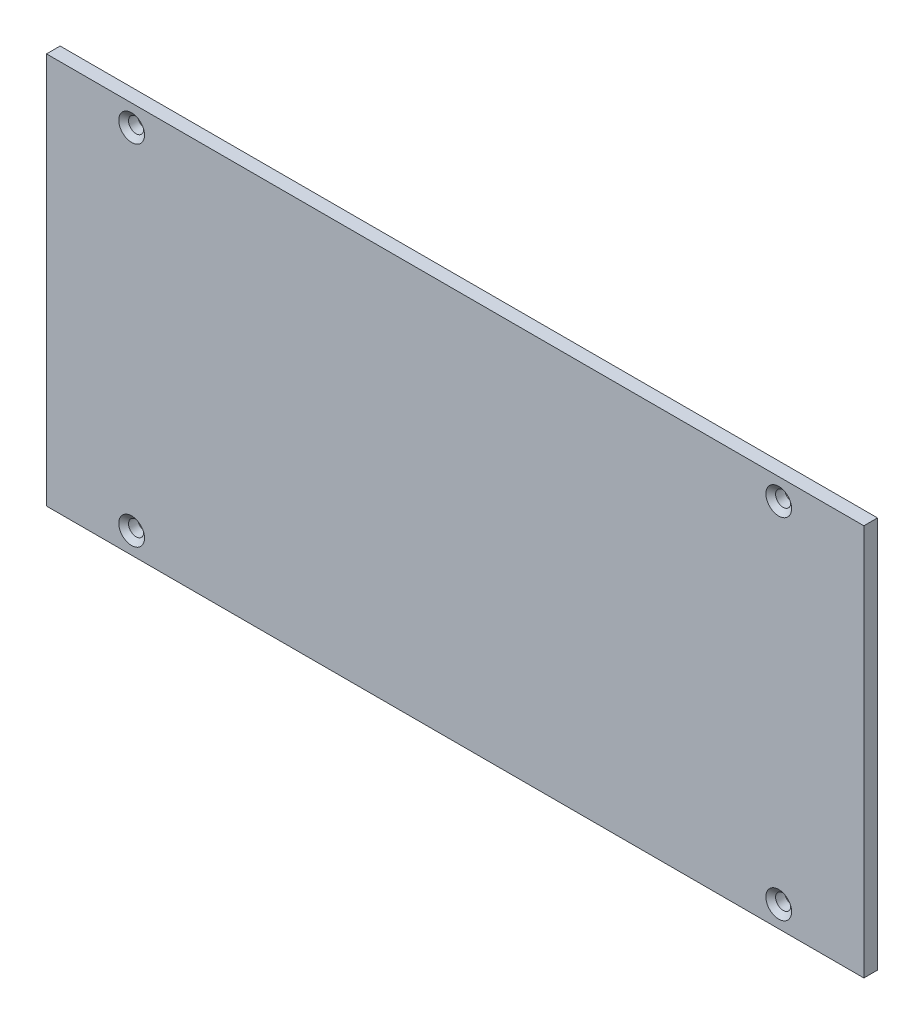
from build123d import *

# Parameters (mm, degrees)
SKETCH1_W                                         = 96
SKETCH1_H                                         = 46
BOSS_EXTRUDE1_DEPTH                               = 1.6002
CSK_FOR_0_FLAT_HEAD_MACHINE_SCREW_100_D           = 1.778
CSK_FOR_0_FLAT_HEAD_MACHINE_SCREW_100_CSINK_D     = 3.0226
CSK_FOR_0_FLAT_HEAD_MACHINE_SCREW_100_CSINK_ANGLE = 100


with BuildPart() as part:
    # Sketch1 → Boss-Extrude1 (new body)
    with BuildSketch(Plane.XY):
        with Locations((48, 23)):
            Rectangle(SKETCH1_W, SKETCH1_H)
    extrude(amount=BOSS_EXTRUDE1_DEPTH)

    # CSK for #0 Flat Head Machine Screw (100)1 (through all)
    with Locations(Plane.XY.offset(1.6002)):
        with Locations((10, 43.5), (10, 2.5), (86, 2.5), (86, 43.5)):
            CounterSinkHole(CSK_FOR_0_FLAT_HEAD_MACHINE_SCREW_100_D / 2, CSK_FOR_0_FLAT_HEAD_MACHINE_SCREW_100_CSINK_D / 2, counter_sink_angle=CSK_FOR_0_FLAT_HEAD_MACHINE_SCREW_100_CSINK_ANGLE)


solid = part.part
